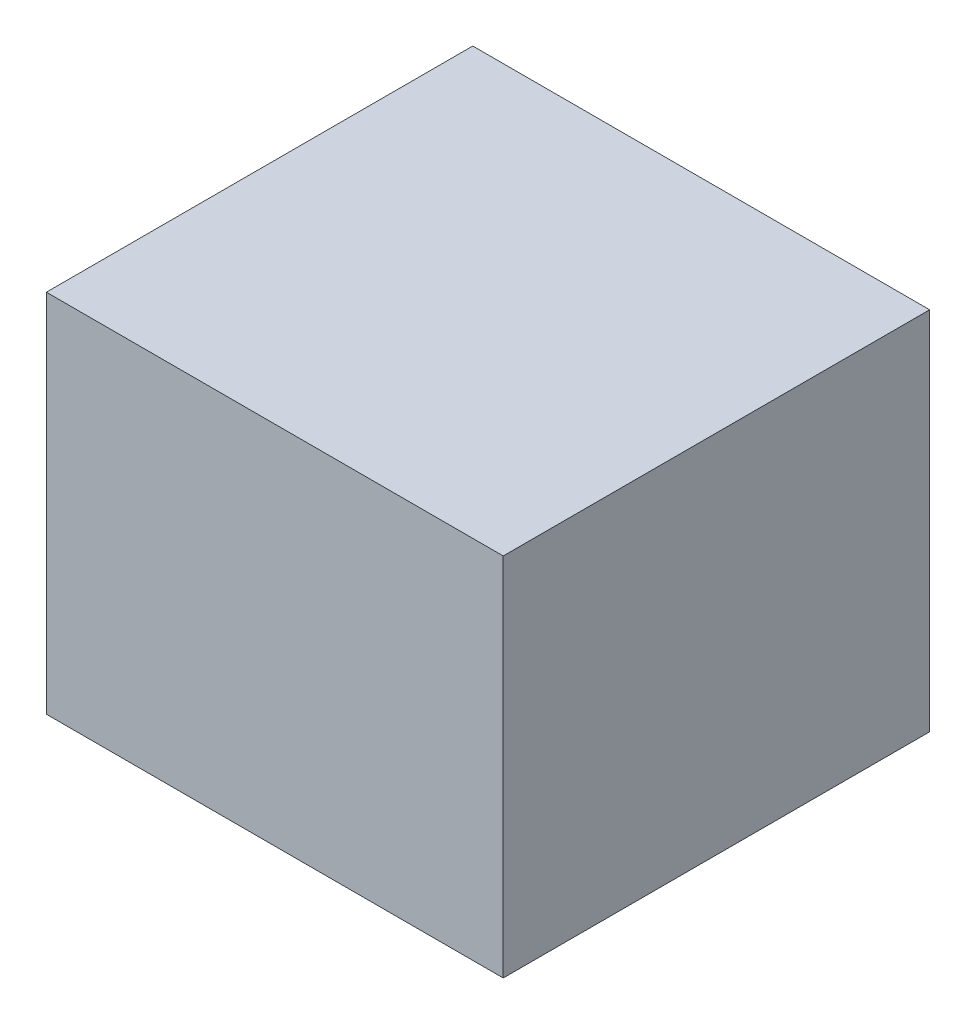
from build123d import *

# Parameters (mm, degrees)
SKETCH1_W           = 75
SKETCH1_H           = 60
BOSS_EXTRUDE1_DEPTH = 70
CAVITY1_START       = 5
CAVITY1_OUTLINE_R   = 0.75
CAVITY1_DEPTH       = 55.9
CAVITY1_2_OUTLINE_R = 0.75
CAVITY1_2_DEPTH     = 31.4
CAVITY1_START_2     = 13
CAVITY1_3_OUTLINE_R = 0.75
CAVITY1_3_DEPTH     = 47.9
CAVITY1_4_OUTLINE_R = 0.75
CAVITY1_4_DEPTH     = 23.4


# Read off the part's stored shape, not the designer's step: Cavity1
with BuildPart() as part:
    # Sketch1 → Boss-Extrude1 (new body)
    with BuildSketch(Plane.XY):
        with Locations((37.5, 30)):
            Rectangle(SKETCH1_W, SKETCH1_H)
    extrude(amount=BOSS_EXTRUDE1_DEPTH)

    # Cavity1 outline → Cavity1 (cut)
    with BuildSketch(Plane.XY.offset(CAVITY1_START)):
        with BuildLine():
            Line((18.46548662, 52.336946082), (7.908006381, 37.670492946))
            Line((7.908006381, 37.670492946), (9.936997433, 36.209946709))
            ThreePointArc((9.936997433, 36.209946709), (8.94403376, 33.444468797), (9.567109894, 30.572949848))
            Line((9.567109894, 30.572949848), (8.245641386, 29.863216812))
            Line((8.245641386, 29.863216812), (18.37116603, 11.010266096))
            Line((18.37116603, 11.010266096), (21.895082052, 12.902887525))
            Line((21.895082052, 12.902887525), (11.769557408, 31.755838241))
            ThreePointArc((11.769557408, 31.755838241), (11.438668953, 33.280776232), (11.965988485, 34.749400472))
            Line((11.965988485, 34.749400472), (20.056953769, 45.989370661))
            ThreePointArc((20.056953769, 45.989370661), (21.356620935, 46.794592998), (22.845349854, 46.446449406))
            ThreePointArc((22.845349854, 46.446449406), (23.927028985, 45.897391402), (25.123551575, 45.697821555))
            Line((25.123551575, 45.697821555), (50.502868756, 45.366563013))
            ThreePointArc((50.502868756, 45.366563013), (52.616494227, 45.804976964), (54.348334803, 47.093521742))
            ThreePointArc((54.348334803, 47.093521742), (56.461375235, 48.37027811), (58.92150101, 48.163329184))
            Line((58.92150101, 48.163329184), (58.956655303, 50.856669359))
            ThreePointArc((58.956655303, 50.856669359), (53.544792902, 53.606340424), (47.557302608, 54.60579307))
            Line((47.557302608, 54.60579307), (23.587024567, 54.918660406))
            ThreePointArc((23.587024567, 54.918660406), (20.710384856, 54.254419425), (18.46548662, 52.336946082))
        make_face()
        with Locations((18.756110409, 15.069070512)):
            Circle(CAVITY1_OUTLINE_R, mode=Mode.SUBTRACT)
        with Locations((37.538899797, 50.828307501)):
            Circle(CAVITY1_OUTLINE_R, mode=Mode.SUBTRACT)
    extrude(amount=CAVITY1_DEPTH, mode=Mode.SUBTRACT)

    # Cavity1 2 outline → Cavity1 2 (cut)
    # profile 1 of 2: a face of its own
    with BuildSketch(Plane.XY.offset(CAVITY1_START)):
        with BuildLine():
            Line((61.054335289, 50.521376908), (55.041269461, 53.046995369))
            ThreePointArc((55.041269461, 53.046995369), (57.060573485, 52.061967221), (58.956655303, 50.856669359))
            Line((58.956655303, 50.856669359), (58.92150101, 48.163329184))
            Line((58.92150101, 48.163329184), (59.892586686, 47.755452074))
            ThreePointArc((59.892586686, 47.755452074), (60.952620575, 47.155751273), (61.844382404, 46.326249172))
            Line((61.844382404, 46.326249172), (66.312422732, 41.068244262))
            ThreePointArc((66.312422732, 41.068244262), (66.987141001, 40.054307304), (67.407914577, 38.911388893))
            Line((67.407914577, 38.911388893), (69.018283104, 32.201939348))
            ThreePointArc((69.018283104, 32.201939348), (69.162099385, 30.992547032), (69.021092891, 29.782823896))
            Line((69.021092891, 29.782823896), (67.426314651, 23.069651593))
            ThreePointArc((67.426314651, 23.069651593), (67.008197192, 21.925758816), (66.335836102, 20.910257235))
            Line((66.335836102, 20.910257235), (61.88002209, 15.641887326))
            ThreePointArc((61.88002209, 15.641887326), (60.948767594, 14.725996436), (59.86612003, 13.995267134))
            Line((59.86612003, 13.995267134), (51.713665819, 9.520058721))
            ThreePointArc((51.713665819, 9.520058721), (46.306249088, 7.211864539), (40.551434527, 6.007694509))
            ThreePointArc((40.551434527, 6.007694509), (32.152585039, 5.712059517), (23.799153538, 6.633067087))
            Line((23.799153538, 6.633067087), (23.436550639, 4.666211949))
            ThreePointArc((23.436550639, 4.666211949), (32.077975822, 3.713451636), (40.766384828, 4.019278967))
            ThreePointArc((40.766384828, 4.019278967), (45.667164707, 4.941518532), (50.36406223, 6.617025293))
            Line((50.36406223, 6.617025293), (53.157281436, 6.890234782))
            Line((53.157281436, 6.890234782), (61.309735647, 11.365443195))
            ThreePointArc((61.309735647, 11.365443195), (62.847708644, 12.403492855), (64.170617702, 13.704576886))
            Line((64.170617702, 13.704576886), (68.626431714, 18.972946795))
            ThreePointArc((68.626431714, 18.972946795), (69.686109361, 20.573432518), (70.345085218, 22.37626975))
            Line((70.345085218, 22.37626975), (71.939863457, 29.089442053))
            ThreePointArc((71.939863457, 29.089442053), (72.162097362, 30.99603151), (71.93543508, 32.902099577))
            Line((71.93543508, 32.902099577), (70.325066554, 39.611549122))
            ThreePointArc((70.325066554, 39.611549122), (69.661904513, 41.4128507), (68.598511823, 43.010870491))
            Line((68.598511823, 43.010870491), (64.130471496, 48.268875401))
            ThreePointArc((64.130471496, 48.268875401), (62.725006351, 49.576215828), (61.054335289, 50.521376908))
        make_face()
        with Locations((55.111079675, 9.691018641)):
            Circle(CAVITY1_2_OUTLINE_R, mode=Mode.SUBTRACT)
    # profile 2 of 2: a face of its own
    with BuildSketch(Plane.XY.offset(CAVITY1_START)):
        with BuildLine():
            Line((21.895082052, 12.902887525), (20.133124041, 11.956576811))
            ThreePointArc((20.133124041, 11.956576811), (22.633217451, 9.122098941), (26.13158906, 7.691669655))
            ThreePointArc((26.13158906, 7.691669655), (41.165451618, 7.861619441), (55.287009069, 13.021805628))
            Line((55.287009069, 13.021805628), (54.29349955, 14.757587538))
            ThreePointArc((54.29349955, 14.757587538), (40.805776793, 9.829012137), (26.446697007, 9.66669041))
            ThreePointArc((26.446697007, 9.66669041), (23.79214447, 10.752095311), (21.895082052, 12.902887525))
        make_face()
    extrude(amount=CAVITY1_2_DEPTH, mode=Mode.SUBTRACT)

    # Cavity1 3 outline → Cavity1 3 (cut)
    with BuildSketch(Plane.XY.offset(CAVITY1_START_2)):
        with Locations((18.756110409, 15.069070512)):
            Circle(CAVITY1_3_OUTLINE_R)
        with Locations((37.538899797, 50.828307501)):
            Circle(CAVITY1_3_OUTLINE_R)
    extrude(amount=CAVITY1_3_DEPTH, mode=Mode.SUBTRACT)

    # Cavity1 4 outline → Cavity1 4 (cut)
    with BuildSketch(Plane.XY.offset(CAVITY1_START_2)):
        with Locations((55.111079675, 9.691018641)):
            Circle(CAVITY1_4_OUTLINE_R)
    extrude(amount=CAVITY1_4_DEPTH, mode=Mode.SUBTRACT)


solid = part.part
